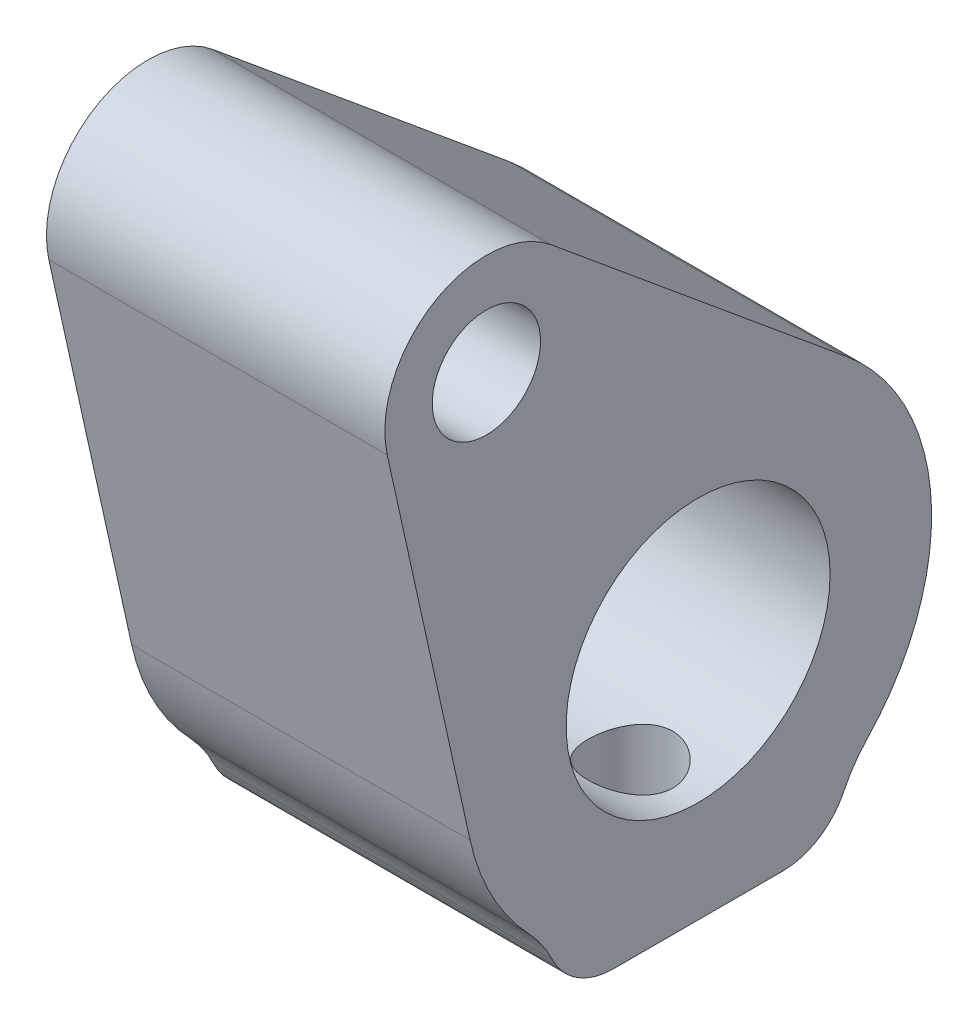
from build123d import *

# Parameters (mm, degrees)
BOSS_EXTRUDE1_START    = -1
SKETCH2_R              = 3.9
BOSS_EXTRUDE1_DEPTH    = 5
M3_CLEARANCE_HOLE1_D   = 3.2
M3_TAPPED_HOLE1_REACH  = 24.345
M3_TAPPED_HOLE1_BORE_R = 1.25
MIRROR3_START          = -6
MIRROR3_OUTLINE_R      = 3.9
MIRROR3_OUTLINE_R_2    = 1.6
MIRROR3_DEPTH          = 5
MIRROR3_START_2        = -6.9
MIRROR3_2_OUTLINE_R    = 1.25
MIRROR3_2_DEPTH        = 3.205747808


with BuildPart() as part:
    # Sketch2 → Boss-Extrude1 (new body)
    with BuildSketch(Plane(origin=(0, 0, 0), x_dir=(0, 0, -1), z_dir=(1, 0, 0)).offset(BOSS_EXTRUDE1_START)):
        with BuildLine():
            Line((2.5, -6.9), (-2.5, -6.9))
            ThreePointArc((-2.5, -6.9), (-3.563882529, -6.593562507), (-4.301751563, -5.768153965))
            ThreePointArc((-4.301751563, -5.768153965), (-4.613436828, -5.232032538), (-5.004243793, -4.750530924))
            ThreePointArc((-5.004243793, -4.750530924), (-6.093212803, -3.237708717), (-6.737511079, -1.488604871))
            Line((-6.737511079, -1.488604871), (-9.185849324, 9.592714537))
            ThreePointArc((-9.185849324, 9.592714537), (-7.820620852, 12.799917558), (-4.343824749, 12.551142838))
            Line((-4.343824749, 12.551142838), (4.399145444, 5.315780221))
            ThreePointArc((4.399145444, 5.315780221), (6.88756759, 0.414020163), (5.004243793, -4.750530924))
            ThreePointArc((5.004243793, -4.750530924), (4.613436828, -5.232032538), (4.301751563, -5.768153965))
            ThreePointArc((4.301751563, -5.768153965), (3.563882529, -6.593562507), (2.5, -6.9))
        make_face()
        Circle(SKETCH2_R, mode=Mode.SUBTRACT)
    extrude(amount=BOSS_EXTRUDE1_DEPTH)

    # M3 Clearance Hole1 (through all)
    with Locations(Plane.ZY.offset(1)):
        with Locations((6.256496681, 10.239934047)):
            Hole(M3_CLEARANCE_HOLE1_D / 2)

    # M3 Tapped Hole1 bore → M3 Tapped Hole1 (cut, up to next)
    with BuildSketch(Plane(origin=(0, -6.9, 1.914772396), x_dir=(-1, 0, 0), z_dir=(0, -1, 0)), mode=Mode.PRIVATE) as m3_tapped_hole1_sk1:
        with Locations((-2, 1.914772396)):
            Circle(M3_TAPPED_HOLE1_BORE_R)
    m3_tapped_hole1_tool1 = extrude(m3_tapped_hole1_sk1.sketch, amount=-M3_TAPPED_HOLE1_REACH, mode=Mode.PRIVATE) & part.part
    add(m3_tapped_hole1_tool1.solids().sort_by_distance((2, -6.9, 0))[0], mode=Mode.SUBTRACT)

    # Mirror3: read off the stored shape, not the designer's step
    # Mirror3 outline → Mirror3 (add)
    with BuildSketch(Plane.YZ.offset(MIRROR3_START)):
        with BuildLine():
            ThreePointArc((-4.750530924, -5.004243793), (0.414020162, -6.88756759), (5.315780221, -4.399145444))
            Line((5.315780221, -4.399145444), (12.551142838, 4.343824749))
            ThreePointArc((12.551142838, 4.343824749), (12.799917558, 7.820620852), (9.592714537, 9.185849324))
            Line((9.592714537, 9.185849324), (-1.488604871, 6.737511079))
            ThreePointArc((-1.488604871, 6.737511079), (-3.237708717, 6.093212803), (-4.750530924, 5.004243793))
            ThreePointArc((-4.750530924, 5.004243793), (-5.232032538, 4.613436828), (-5.768153965, 4.301751563))
            ThreePointArc((-5.768153965, 4.301751563), (-6.593562507, 3.563882529), (-6.9, 2.5))
            Line((-6.9, 2.5), (-6.9, -2.5))
            ThreePointArc((-6.9, -2.5), (-6.593562507, -3.563882529), (-5.768153965, -4.301751563))
            ThreePointArc((-5.768153965, -4.301751563), (-5.232032538, -4.613436828), (-4.750530924, -5.004243793))
        make_face()
        Circle(MIRROR3_OUTLINE_R, mode=Mode.SUBTRACT)
        with Locations((10.239934047, 6.256496681)):
            Circle(MIRROR3_OUTLINE_R_2, mode=Mode.SUBTRACT)
    extrude(amount=MIRROR3_DEPTH)

    # Mirror3 2 outline → Mirror3 2 (cut)
    with BuildSketch(Plane(origin=(0, 0, 0), x_dir=(1, 0, 0), z_dir=(0, 1, 0)).offset(MIRROR3_START_2)):
        with Locations((-4, 0)):
            Circle(MIRROR3_2_OUTLINE_R)
    extrude(amount=MIRROR3_2_DEPTH, mode=Mode.SUBTRACT)


solid = part.part
